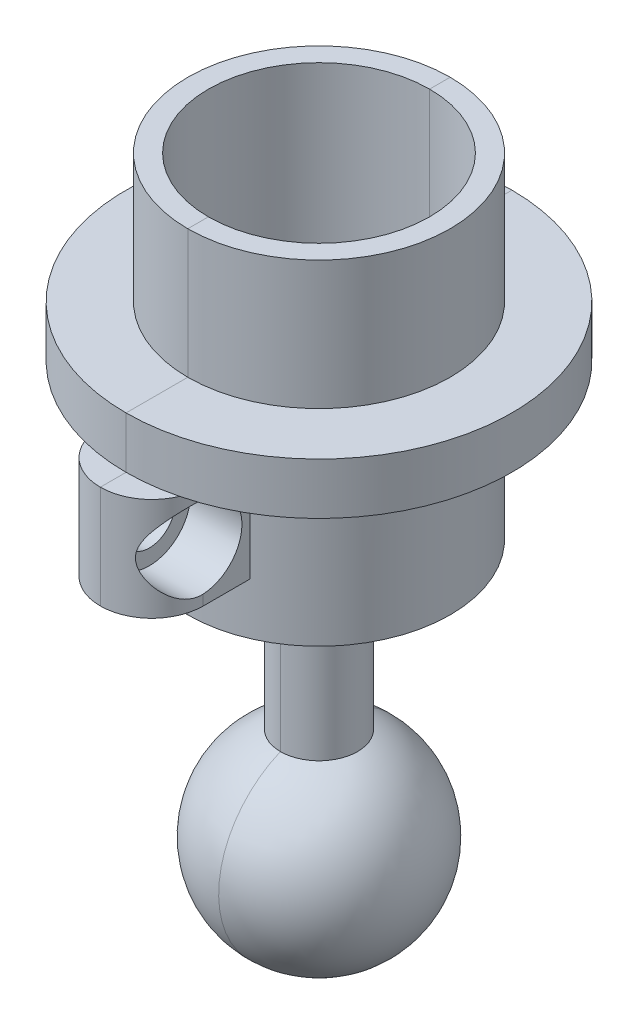
from build123d import *
from build123d.topology import SkipClean

# Parameters (mm, degrees)
SKETCH2_R           = 5.1
BOSS_EXTRUDE1_DEPTH = 1
SKETCH3_R           = 5.1
SKETCH3_R_2         = 4.3
BOSS_EXTRUDE2_DEPTH = 12
CUT_EXTRUDE2_DEPTH  = 1
SKETCH7_R           = 7.5
SKETCH7_R_2         = 5.1
BOSS_EXTRUDE4_DEPTH = 2
BOSS_EXTRUDE5_REACH = 24.482
SKETCH11_W          = 4
SKETCH11_H          = 4
CUT_EXTRUDE3_DEPTH  = 10
SKETCH13_3_R        = 1.6
SKETCH13_3_R_2      = 1
CUT_EXTRUDE4_DEPTH  = 2
FILLET1_R           = 2


# Read off the part's stored shape, not the designer's step: Mirror1
with BuildPart() as part:
    # Sketch2 → Boss-Extrude1 (new body)
    with BuildSketch(Plane(origin=(0, 0, 0), x_dir=(1, 0, 0), z_dir=(0, 1, 0))):
        with Locations(Location((0, 0, 0), (0, 0, 270))):
            Circle(SKETCH2_R)
    extrude(amount=BOSS_EXTRUDE1_DEPTH)

    # Sketch3 → Boss-Extrude2 (add)
    with BuildSketch(Plane(origin=(0, 1, 0), x_dir=(1, 0, 0), z_dir=(0, 1, 0))):
        with Locations(Location((0, 0, 0), (0, 0, 270))):
            Circle(SKETCH3_R)
        with Locations(Location((0, 0, 0), (0, 0, 270))):
            Circle(SKETCH3_R_2, mode=Mode.SUBTRACT)
    extrude(amount=BOSS_EXTRUDE2_DEPTH)

    # Sketch6 → Cut-Extrude2 (cut)
    with BuildSketch(Plane(origin=(0, 1, 0), x_dir=(1, 0, 0), z_dir=(0, 1, 0))):
        with BuildLine():
            ThreePointArc((-1.767767, 1.767767), (-2.165064, 1.25), (-2.414815, 0.647048))
            Line((-2.414815, 0.647048), (-3.187555, 0.854103))
            ThreePointArc((-3.187555, 0.854103), (-2.857884, 1.65), (-2.333452, 2.333452))
            Line((-2.333452, 2.333452), (-1.767767, 1.767767))
        make_face()
        with BuildLine():
            ThreePointArc((2.414815, 0.647048), (2.165064, 1.25), (1.767767, 1.767767))
            Line((1.767767, 1.767767), (2.333452, 2.333452))
            ThreePointArc((2.333452, 2.333452), (2.857884, 1.65), (3.187555, 0.854103))
            Line((3.187555, 0.854103), (2.414815, 0.647048))
        make_face()
        with BuildLine():
            ThreePointArc((1.767767, -1.767767), (2.165064, -1.25), (2.414815, -0.647048))
            Line((2.414815, -0.647048), (3.187555, -0.854103))
            ThreePointArc((3.187555, -0.854103), (2.857884, -1.65), (2.333452, -2.333452))
            Line((2.333452, -2.333452), (1.767767, -1.767767))
        make_face()
        with BuildLine():
            ThreePointArc((-0.647048, -2.414815), (0, -2.5), (0.647048, -2.414815))
            Line((0.647048, -2.414815), (0.854103, -3.187555))
            ThreePointArc((0.854103, -3.187555), (0, -3.3), (-0.854103, -3.187555))
            Line((-0.854103, -3.187555), (-0.647048, -2.414815))
        make_face()
        with BuildLine():
            ThreePointArc((-2.414815, -0.647048), (-2.165064, -1.25), (-1.767767, -1.767767))
            Line((-1.767767, -1.767767), (-2.333452, -2.333452))
            ThreePointArc((-2.333452, -2.333452), (-2.857884, -1.65), (-3.187555, -0.854103))
            Line((-3.187555, -0.854103), (-2.414815, -0.647048))
        make_face()
        with BuildLine():
            ThreePointArc((0.647048, 2.414815), (0, 2.5), (-0.647048, 2.414815))
            Line((-0.647048, 2.414815), (-0.854103, 3.187555))
            ThreePointArc((-0.854103, 3.187555), (0, 3.3), (0.854103, 3.187555))
            Line((0.854103, 3.187555), (0.647048, 2.414815))
        make_face()
    extrude(amount=-CUT_EXTRUDE2_DEPTH, mode=Mode.SUBTRACT)

    # Sketch7 → Boss-Extrude4 (add)
    with BuildSketch(Plane(origin=(0, 6, 0), x_dir=(1, 0, 0), z_dir=(0, 1, 0))):
        with Locations(Location((0, 0, 0), (0, 0, 270))):
            Circle(SKETCH7_R)
        with Locations(Location((0, 0, 0), (0, 0, 270))):
            Circle(SKETCH7_R_2, mode=Mode.SUBTRACT)
    extrude(amount=BOSS_EXTRUDE4_DEPTH)

    # Sketch8 → Revolve1 (revolve)
    with SkipClean():  # the faces are left unmerged after this step: merging them gives an invalid solid
        with BuildSketch(Plane(origin=(0, 0, 0), x_dir=(0, 0, -1), z_dir=(1, 0, 0)), mode=Mode.PRIVATE) as revolve1_sk:
            with BuildLine():
                ThreePointArc((1.5, -6.4), (0.764853, -6.175735), (0, -6.1))
                Line((0, -6.1), (0, -10))
                Line((0, -10), (0, -13.9))
                ThreePointArc((0, -13.9), (2.757716, -12.757716), (3.9, -10))
                ThreePointArc((3.9, -10), (3.244996, -7.836669), (1.5, -6.4))
            make_face()
            with BuildLine():
                Line((0, -10), (0, -6.1))
                ThreePointArc((0, -6.1), (-0.764853, -6.175735), (-1.5, -6.4))
                ThreePointArc((-1.5, -6.4), (-3.824265, -10.764853), (0, -13.9))
                Line((0, -13.9), (0, -10))
            make_face()
            with BuildLine():
                Line((0, -6.1), (0, 0))
                Line((0, 0), (-1.5, 0))
                Line((-1.5, 0), (-1.5, -6.4))
                ThreePointArc((-1.5, -6.4), (-0.764853, -6.175735), (0, -6.1))
            make_face()
        revolve(revolve1_sk.sketch.rotate(Axis((0, 0, 0), (0, -1, 0)), 180), axis=Axis((0, 0, 0), (0, -1, 0)))

    # Sketch11 → Boss-Extrude5 (add, up to next)
    with BuildSketch(Plane.XY.offset(8.5), mode=Mode.PRIVATE) as boss_extrude5_sk1:
        with Locations((0, 4)):
            Rectangle(SKETCH11_W, SKETCH11_H)
    boss_extrude5_tool1 = extrude(boss_extrude5_sk1.sketch, amount=-BOSS_EXTRUDE5_REACH, mode=Mode.PRIVATE) - part.part
    add(boss_extrude5_tool1.solids().sort_by_distance((0, 4, 8.5))[0])

    # Sketch13 → Cut-Extrude3 (cut)
    with BuildSketch(Plane(origin=(2, 0, 0), x_dir=(0, 0, -1), z_dir=(1, 0, 0))):
        with BuildLine():
            ThreePointArc((-7.285301, 4.724229), (-7.31997, 3.31044), (-5.906181, 3.275771))
            Line((-5.906181, 3.275771), (-7.285301, 4.724229))
        make_face()
        with BuildLine():
            Line((-7.285301, 4.724229), (-5.906181, 3.275771))
            ThreePointArc((-5.906181, 3.275771), (-5.676622, 3.60602), (-5.595741, 4))
            ThreePointArc((-5.595741, 4), (-6.201761, 4.919119), (-7.285301, 4.724229))
        make_face()
    extrude(amount=-CUT_EXTRUDE3_DEPTH, mode=Mode.SUBTRACT)

    # Sketch13<3> → Cut-Extrude4 (cut)
    with BuildSketch(Plane(origin=(2, 0, 0), x_dir=(0, 0, -1), z_dir=(1, 0, 0))):
        with Locations(Location((-6.595741, 4, 0), (0, 0, 90))):
            Circle(SKETCH13_3_R)
        with Locations(Location((-6.595741, 4, 0), (0, 0, 90))):
            Circle(SKETCH13_3_R_2, mode=Mode.SUBTRACT)
    extrude(amount=-CUT_EXTRUDE4_DEPTH, mode=Mode.SUBTRACT)

    # Fillet1
    # the kernel refuses this fillet: 2 mm, written as the material it takes off along each edge
    with BuildSketch(Plane(origin=(-2, 6, 8.5), x_dir=(1, 0, 0), z_dir=(0, -1, 0)), Plane(origin=(2, -3, 8.5), x_dir=(-1, 0, 0), z_dir=(0, 1, 0))) as fillet1_piece_1:
        with BuildLine():
            CenterArc((FILLET1_R, -FILLET1_R), FILLET1_R, 90, 90)
            Line((0, -FILLET1_R), (0, 0))
            Line((0, 0), (FILLET1_R, 0))
        make_face()
    extrude(amount=9, mode=Mode.SUBTRACT)

    # Mirror1
    split(bisect_by=Plane.XY, keep=Keep.TOP)

    # Mirror1 2: part across plane


with BuildPart() as part_1:
    add(part.part)
    add(part.part.mirror(Plane.XY))


with BuildPart() as body_2:
    # Split1: the piece on the far side of the plane
    add(part_1.part)
    split(bisect_by=Plane(origin=(0, 0, 0), x_dir=(0, 0, 1), z_dir=(1, 0, 0)), keep=Keep.BOTTOM)


with BuildPart() as part_2:
    add(part_1.part)

    # Split1
    split(bisect_by=Plane(origin=(0, 0, 0), x_dir=(0, 0, 1), z_dir=(1, 0, 0)), keep=Keep.TOP)


solid = Compound([body_2.part, part_2.part])
